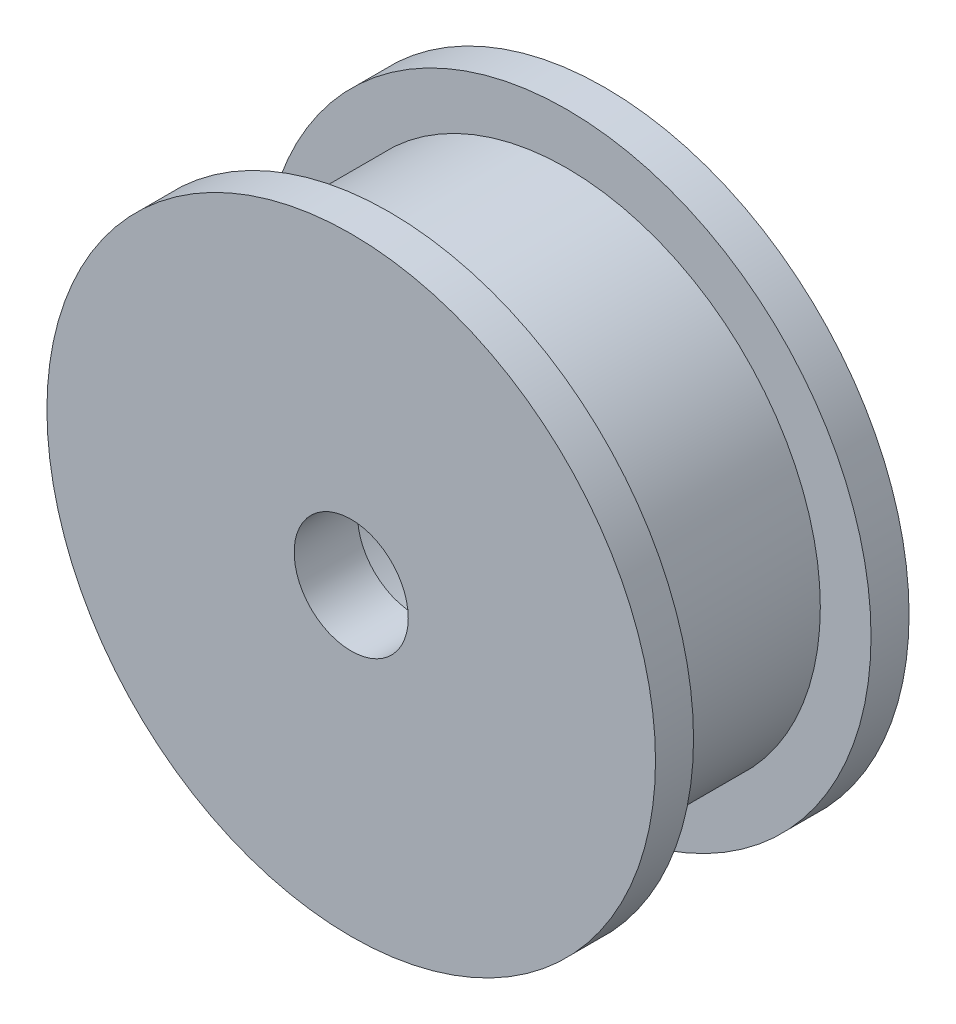
from build123d import *

# Parameters (mm, degrees)
SKETCH1_R           = 10
BOSS_EXTRUDE1_DEPTH = 7
SKETCH2_R           = 12
BOSS_EXTRUDE2_DEPTH = 1.5
BOSS_EXTRUDE3_START = 1.5
SKETCH3_R           = 12
BOSS_EXTRUDE3_DEPTH = 1.5
SKETCH4_R           = 6.5
CUT_EXTRUDE1_DEPTH  = 20.697715604
SKETCH5_R           = 6.5
SKETCH5_R_2         = 2.25
BOSS_EXTRUDE4_DEPTH = 2.5


with BuildPart() as part:
    # Sketch1 → Boss-Extrude1 (new body)
    with BuildSketch(Plane.XY):
        Circle(SKETCH1_R)
    extrude(amount=BOSS_EXTRUDE1_DEPTH)

    # Sketch2 → Boss-Extrude2 (add)
    with BuildSketch(Plane.XY.offset(7)):
        Circle(SKETCH2_R)
    extrude(amount=BOSS_EXTRUDE2_DEPTH)

    # Sketch3 → Boss-Extrude3 (add)
    with BuildSketch(Plane(origin=(0, 0, 0), x_dir=(-1, 0, 0), z_dir=(0, 0, -1)).offset(BOSS_EXTRUDE3_START)):
        Circle(SKETCH3_R)
    extrude(amount=-BOSS_EXTRUDE3_DEPTH)

    # Sketch4 → Cut-Extrude1 (cut, through all)
    with BuildSketch(Plane.XY.offset(8.5)):
        Circle(SKETCH4_R)
    extrude(amount=-CUT_EXTRUDE1_DEPTH, mode=Mode.SUBTRACT)

    # Sketch5 → Boss-Extrude4 (add)
    with BuildSketch(Plane.XY.offset(8.5)):
        Circle(SKETCH5_R)
        Circle(SKETCH5_R_2, mode=Mode.SUBTRACT)
    extrude(amount=-BOSS_EXTRUDE4_DEPTH)


solid = part.part
